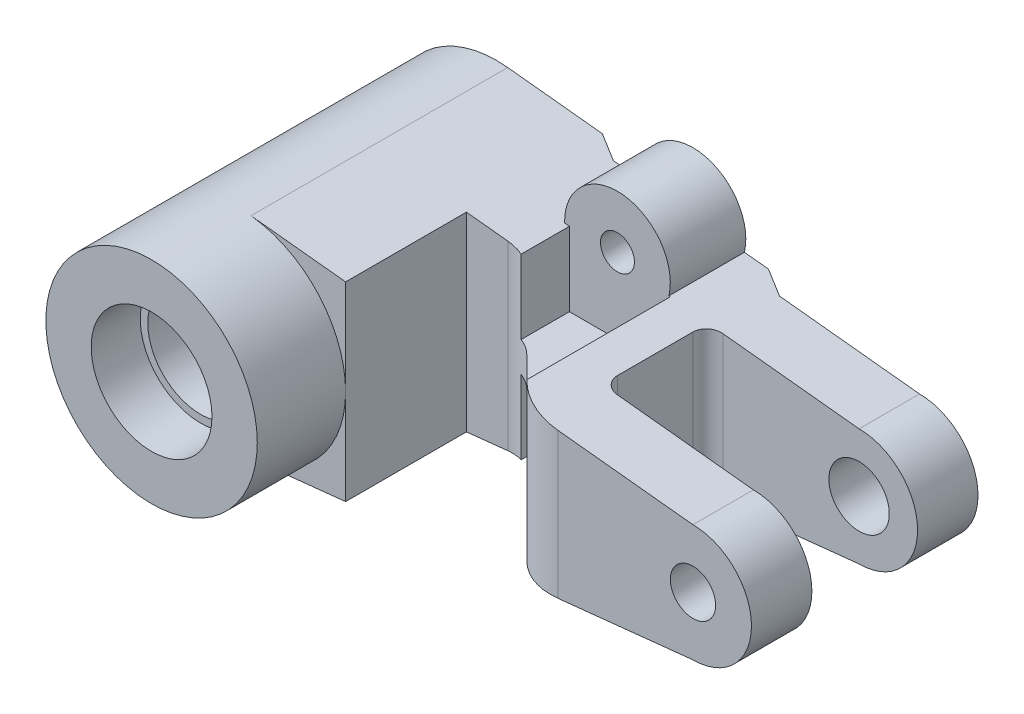
from build123d import *

# Parameters (mm, degrees)
SKETCH1_R                = 7
SKETCH1_R_2              = 3.5
CYLINDER_DEPTH           = 22.85
SKETCH2_R                = 4
BORE_1_DEPTH             = 3.25
BORE_START               = -3.25
SKETCH3_R                = 4
BORE_2_DEPTH             = 3.25
ARM_DEPTH                = 17
SKETCH5_R                = 3.5
OUTER_HOLE_SURFACE_DEPTH = 6
SKETCH6_R                = 1.125
OUTER_HOLE_DEPTH         = 6
SIDE_FEATURES_DEPTH      = 22
RIB_START                = -11
SKETCH10_W               = 6.681980515
SKETCH10_H               = 4.897943925
RIB_DEPTH                = 9.5
SKETCH13_R               = 1.5
BOTTOM_HOLE_DEPTH        = 4


# Read off the part's stored shape, not the designer's step: Top Counter-sunk
with BuildPart() as part:
    # Sketch1 → Cylinder (new body)
    with BuildSketch(Plane.XY):
        with Locations(Location((0, 0, 0), (0, 0, 180))):
            Circle(SKETCH1_R)
        with Locations(Location((0, 0, 0), (0, 0, 180))):
            Circle(SKETCH1_R_2, mode=Mode.SUBTRACT)
    extrude(amount=CYLINDER_DEPTH)

    # Sketch2 → Bore 1 (cut)
    with BuildSketch(Plane.XY.offset(22.85)):
        Circle(SKETCH2_R)
    extrude(amount=-BORE_1_DEPTH, mode=Mode.SUBTRACT)

    # Sketch3 → Bore 2 (cut)
    with BuildSketch(Plane(origin=(0, 0, 0), x_dir=(-1, 0, 0), z_dir=(0, 0, -1)).offset(BORE_START)):
        with Locations(Location((0, 0, 0), (0, 0, 180))):
            Circle(SKETCH3_R)
    extrude(amount=BORE_2_DEPTH, mode=Mode.SUBTRACT)

    # Sketch4 → Arm (add)
    with BuildSketch(Plane.XY):
        with BuildLine():
            Line((0.734153157, 6.961394914), (30, 3.875))
            ThreePointArc((30, 3.875), (33.875, 0), (30, -3.875))
            Line((30, -3.875), (0.734153157, -6.961394914))
            ThreePointArc((0.734153157, -6.961394914), (7, 0), (0.734153157, 6.961394914))
        make_face()
    extrude(amount=ARM_DEPTH)

    # Sketch5 → Outer Hole surface (add)
    with BuildSketch(Plane(origin=(0, 0, 0), x_dir=(-1, 0, 0), z_dir=(0, 0, -1))):
        with Locations((-14, 6)):
            Circle(SKETCH5_R)
    extrude(amount=-OUTER_HOLE_SURFACE_DEPTH)

    # Sketch6 → Outer hole (cut)
    with BuildSketch(Plane(origin=(0, 0, 0), x_dir=(-1, 0, 0), z_dir=(0, 0, -1))):
        with Locations((-14, 6)):
            Circle(SKETCH6_R)
    extrude(amount=-OUTER_HOLE_DEPTH, mode=Mode.SUBTRACT)

    # Sketch8 → side Features (cut)
    with BuildSketch(Plane(origin=(0, 10, 0), x_dir=(1, 0, 0), z_dir=(0, 1, 0))):
        with BuildLine():
            Line((21, -6), (40, -6))
            Line((40, -6), (40, -13))
            Line((40, -13), (21, -13))
            ThreePointArc((21, -13), (20.292893219, -12.707106781), (20, -12))
            Line((20, -12), (20, -7))
            ThreePointArc((20, -7), (20.292893219, -6.292893219), (21, -6))
        make_face()
        with BuildLine():
            Line((7, -19), (7, -9))
            Line((7, -9), (9.757359313, -9))
            ThreePointArc((9.757359313, -9), (10.90540961, -9.228361402), (11.878679656, -9.878679656))
            Line((11.878679656, -9.878679656), (17.535533906, -15.535533906))
            ThreePointArc((17.535533906, -15.535533906), (19.15765065, -16.619397663), (21.071067812, -17))
            Line((21.071067812, -17), (27, -17))
            Line((27, -17), (27, -19))
            Line((27, -19), (7, -19))
        make_face()
        Polygon((7, 0), (8.732050808, -1), (19, -1), (20.732050808, -2), (40, -2), (40, 0), align=None)
    extrude(amount=-SIDE_FEATURES_DEPTH, mode=Mode.SUBTRACT)

    # Sketch10 → Rib (cut)
    with BuildSketch(Plane.XY.offset(17).offset(RIB_START)):
        with Locations((14.159009743, 3.448971963)):
            Rectangle(SKETCH10_W, SKETCH10_H)
        with Locations((14.159009743, -3.448971963)):
            Rectangle(SKETCH10_W, SKETCH10_H)
    extrude(amount=RIB_DEPTH, mode=Mode.SUBTRACT)

    # Top Counter-sunk outline → Top Counter-sunk (revolve, cut)
    with BuildSketch(Plane(origin=(30, 0, 0), x_dir=(1, 0, 0), z_dir=(0, -1, 0))):
        Polygon((2, 3.150368407), (2, 6), (0, 6), (0, 2), (3, 2), align=None)
    revolve(axis=Axis((30, 0, 0), (0, 0, 1)), mode=Mode.SUBTRACT)

    # Sketch13 → Bottom hole (cut)
    with BuildSketch(Plane.XY.offset(17)):
        with Locations((30, 0)):
            Circle(SKETCH13_R)
    extrude(amount=-BOTTOM_HOLE_DEPTH, mode=Mode.SUBTRACT)


solid = part.part
